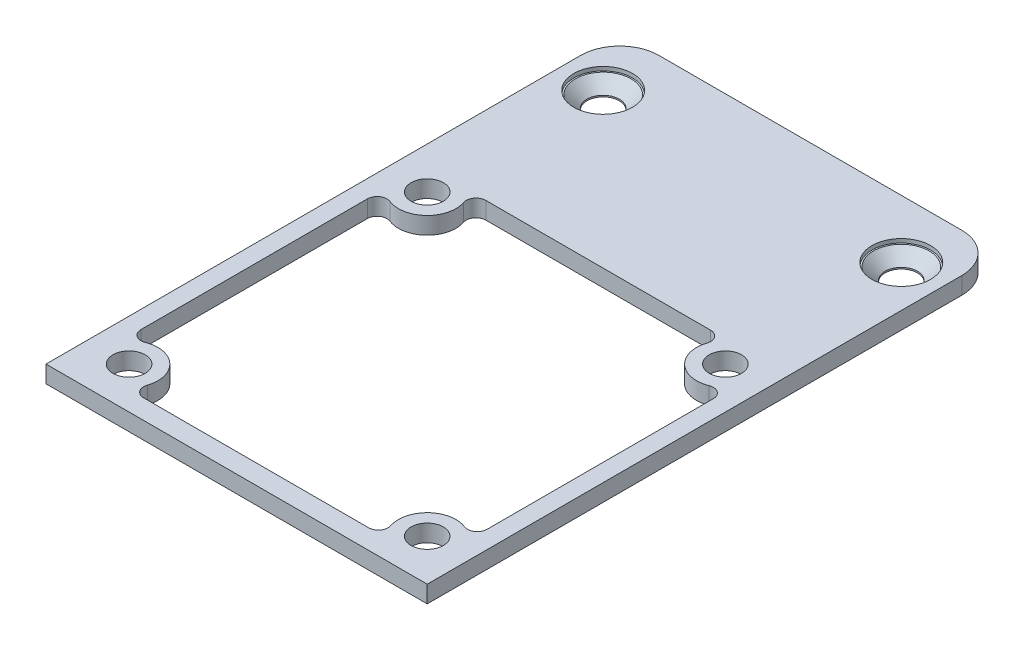
from build123d import *

# Parameters (mm, degrees)
SKETCH1_R               = 1.65
BASE_SHAPE_DEPTH        = 1.75
MILLING_FILLETS_R       = 1
SKETCH3_R               = 3
SCREW_HEAD_CUT_DEPTH    = 0.4
SCREW_HEAD_CHAMFER_SIZE = 1.2


with BuildPart() as part:
    # Sketch1 → Base shape (new body)
    with BuildSketch(Plane(origin=(0, 0, 0), x_dir=(1, 0, 0), z_dir=(0, 1, 0))):
        with BuildLine():
            Line((15.5, 39.2), (-15.5, 39.2))
            ThreePointArc((-15.5, 39.2), (-18.328427125, 38.028427125), (-19.5, 35.2))
            Line((-19.5, 35.2), (-19.5, -19.5))
            Line((-19.5, -19.5), (19.5, -19.5))
            Line((19.5, -19.5), (19.5, 35.2))
            ThreePointArc((19.5, 35.2), (18.328427125, 38.028427125), (15.5, 39.2))
        make_face()
        with BuildLine():
            Line((17.7, 13.606832327), (17.7, -13.606832327))
            ThreePointArc((17.7, -13.606832327), (13.284874461, -13.049822367), (13.341630288, -17.499583304))
            Line((13.341630288, -17.499583304), (-13.341630288, -17.499583304))
            ThreePointArc((-13.341630288, -17.499583304), (-13.284874461, -13.049822367), (-17.7, -13.606832327))
            Line((-17.7, -13.606832327), (-17.7, 13.606832327))
            ThreePointArc((-17.7, 13.606832327), (-13.284874461, 13.049822367), (-13.341630288, 17.499583304))
            Line((-13.341630288, 17.499583304), (13.341630288, 17.499583304))
            ThreePointArc((13.341630288, 17.499583304), (13.284874461, 13.049822367), (17.7, 13.606832327))
        make_face(mode=Mode.SUBTRACT)
        with Locations((-15.25, 33.25)):
            Circle(SKETCH1_R, mode=Mode.SUBTRACT)
        with Locations((15.25, 33.25)):
            Circle(SKETCH1_R, mode=Mode.SUBTRACT)
        with Locations((15.25, -15.25)):
            Circle(SKETCH1_R, mode=Mode.SUBTRACT)
        with Locations((15.25, 15.25)):
            Circle(SKETCH1_R, mode=Mode.SUBTRACT)
        with Locations((-15.25, 15.25)):
            Circle(SKETCH1_R, mode=Mode.SUBTRACT)
        with Locations((-15.25, -15.25)):
            Circle(SKETCH1_R, mode=Mode.SUBTRACT)
    extrude(amount=BASE_SHAPE_DEPTH)

    # Milling fillets
    milling_fillets_edges = [part.edges().sort_by_distance(p)[0] for p in [
        (-17.7, 0.875, 13.606832327),
        (-13.341630288, 0.875, 17.499583304),
        (13.341630288, 0.875, 17.499583304),
        (17.7, 0.875, 13.606832327),
        (17.7, 0.875, -13.606832327),
        (13.341630288, 0.875, -17.499583304),
        (-13.341630288, 0.875, -17.499583304),
        (-17.7, 0.875, -13.606832327),
    ]]
    fillet(milling_fillets_edges, radius=MILLING_FILLETS_R)

    # Sketch3 → Screw head cut (cut)
    with BuildSketch(Plane(origin=(0, 1.75, 0), x_dir=(1, 0, 0), z_dir=(0, 1, 0))):
        with Locations((-15.25, 33.25)):
            Circle(SKETCH3_R)
        with Locations((15.25, 33.25)):
            Circle(SKETCH3_R)
    extrude(amount=-SCREW_HEAD_CUT_DEPTH, mode=Mode.SUBTRACT)

    # Screw head chamfer
    screw_head_chamfer_edges = [part.edges().sort_by_distance(p)[0] for p in [
        (13.6, 1.35, -33.25),
        (-16.9, 1.35, -33.25),
    ]]
    chamfer(screw_head_chamfer_edges, length=SCREW_HEAD_CHAMFER_SIZE)


solid = part.part
